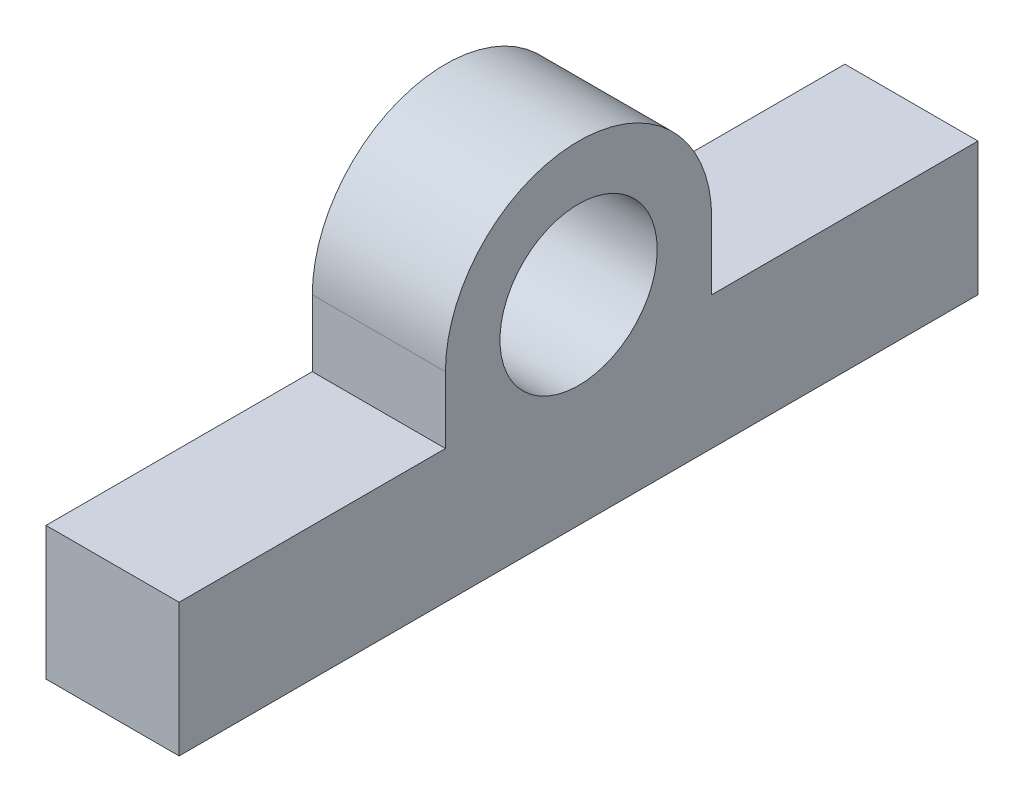
from build123d import *

# Parameters (mm, degrees)
BOSS_EXTRUDE1_DEPTH = 12.7
SKETCH2_R           = 7.5
CUT_EXTRUDE1_DEPTH  = 84.521209881
SKETCH3_R           = 2
CUT_EXTRUDE2_DEPTH  = 7


with BuildPart() as part:
    # Sketch1 → Boss-Extrude1 (new body)
    with BuildSketch(Plane(origin=(0, 0, 0), x_dir=(0, 0, -1), z_dir=(1, 0, 0))):
        with BuildLine():
            Line((0, 0), (76.2, 0))
            Line((76.2, 0), (76.2, 12.7))
            Line((76.2, 12.7), (50.8, 12.7))
            Line((50.8, 12.7), (50.8, 19.05))
            ThreePointArc((50.8, 19.05), (38.1, 31.75), (25.4, 19.05))
            Line((25.4, 19.05), (25.4, 12.7))
            Line((25.4, 12.7), (0, 12.7))
            Line((0, 12.7), (0, 0))
        make_face()
    extrude(amount=BOSS_EXTRUDE1_DEPTH)

    # Sketch2 → Cut-Extrude1 (cut, through all)
    with BuildSketch(Plane(origin=(12.7, 0, 0), x_dir=(0, 0, -1), z_dir=(1, 0, 0))):
        with Locations((38.1, 19.05)):
            Circle(SKETCH2_R)
    extrude(amount=-CUT_EXTRUDE1_DEPTH, mode=Mode.SUBTRACT)

    # Sketch3 → Cut-Extrude2 (cut)
    with BuildSketch(Plane.XZ):
        with Locations((6.35, -12.7)):
            Circle(SKETCH3_R)
        with Locations((6.35, -63.5)):
            Circle(SKETCH3_R)
    extrude(amount=-CUT_EXTRUDE2_DEPTH, mode=Mode.SUBTRACT)


solid = part.part
